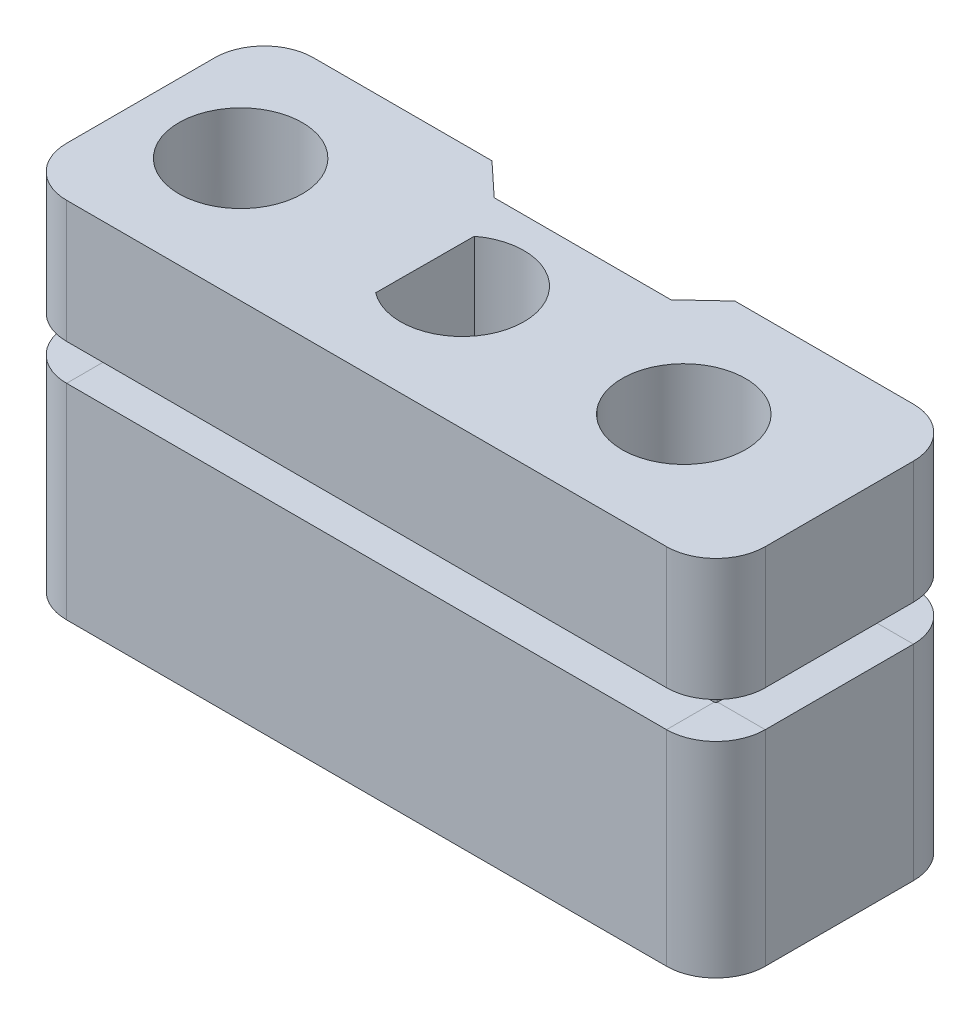
from build123d import *

# Parameters (mm, degrees)
SKETCH1_R           = 2.5
BOSS_EXTRUDE2_DEPTH = 14.72
CUT_SWEEP1_START    = 8.3
CUT_SWEEP1_DEPTH    = 1.47


# Read off the part's stored shape, not the designer's step: Cut-Sweep1
with BuildPart() as part:
    # Sketch1 → Boss-Extrude2 (new body)
    with BuildSketch(Plane(origin=(0, 0, 0), x_dir=(1, 0, 0), z_dir=(0, 1, 0))):
        with BuildLine():
            Line((-12.15, -5), (12.15, -5))
            ThreePointArc((12.15, -5), (13.564213562, -4.414213562), (14.15, -3))
            Line((14.15, -3), (14.15, 3))
            ThreePointArc((14.15, 3), (13.564213562, 4.414213562), (12.15, 5))
            Line((12.15, 5), (4.92, 5))
            Line((4.92, 5), (3.58, 3.75))
            Line((3.58, 3.75), (-3.58, 3.75))
            Line((-3.58, 3.75), (-4.92, 5))
            Line((-4.92, 5), (-12.15, 5))
            ThreePointArc((-12.15, 5), (-13.564213562, 4.414213562), (-14.15, 3))
            Line((-14.15, 3), (-14.15, -3))
            ThreePointArc((-14.15, -3), (-13.564213562, -4.414213562), (-12.15, -5))
        make_face()
        with Locations(Location((7.85, 0, 0), (0, 0, 270))):
            Circle(SKETCH1_R, mode=Mode.SUBTRACT)
        with Locations(Location((-10.1, 0, 0), (0, 0, 270))):
            Circle(SKETCH1_R, mode=Mode.SUBTRACT)
        with BuildLine():
            Line((-2.631143176, 1.995377842), (-2.646508574, -1.983686381))
            ThreePointArc((-2.646508574, -1.983686381), (1.374981361, -0.00965383), (-2.631143176, 1.995377842))
        make_face(mode=Mode.SUBTRACT)
    extrude(amount=BOSS_EXTRUDE2_DEPTH)

    # Cut-Sweep1 outline → Cut-Sweep1 (cut)
    with BuildSketch(Plane(origin=(0, 0, 0), x_dir=(1, 0, 0), z_dir=(0, 1, 0)).offset(CUT_SWEEP1_START)):
        with BuildLine():
            ThreePointArc((-12.15, 5), (-13.564213562, 4.414213562), (-14.15, 3))
            Line((-14.15, 3), (-14.15, -3))
            ThreePointArc((-14.15, -3), (-13.564213562, -4.414213562), (-12.15, -5))
            Line((-12.15, -5), (12.15, -5))
            ThreePointArc((12.15, -5), (13.564213562, -4.414213562), (14.15, -3))
            Line((14.15, -3), (14.15, 3))
            ThreePointArc((14.15, 3), (13.564213562, 4.414213562), (12.15, 5))
            Line((12.15, 5), (4.92, 5))
            Line((4.92, 5), (3.58, 3.75))
            Line((3.58, 3.75), (-3.58, 3.75))
            Line((-3.58, 3.75), (-4.92, 5))
            Line((-4.92, 5), (-12.15, 5))
        make_face()
        with BuildLine():
            ThreePointArc((-12.22, -1.324990566), (-12.6, 0), (-12.22, 1.324990566))
            Line((-12.22, 1.324990566), (-12.22, 3))
            ThreePointArc((-12.22, 3), (-12.199497475, 3.049497475), (-12.15, 3.07))
            Line((-12.15, 3.07), (12.15, 3.07))
            ThreePointArc((12.15, 3.07), (12.199497475, 3.049497475), (12.22, 3))
            Line((12.22, 3), (12.22, -3))
            ThreePointArc((12.22, -3), (12.199497475, -3.049497475), (12.15, -3.07))
            Line((12.15, -3.07), (-12.15, -3.07))
            ThreePointArc((-12.15, -3.07), (-12.199497475, -3.049497475), (-12.22, -3))
            Line((-12.22, -3), (-12.22, -1.324990566))
        make_face(mode=Mode.SUBTRACT)
    extrude(amount=CUT_SWEEP1_DEPTH, mode=Mode.SUBTRACT)


solid = part.part
